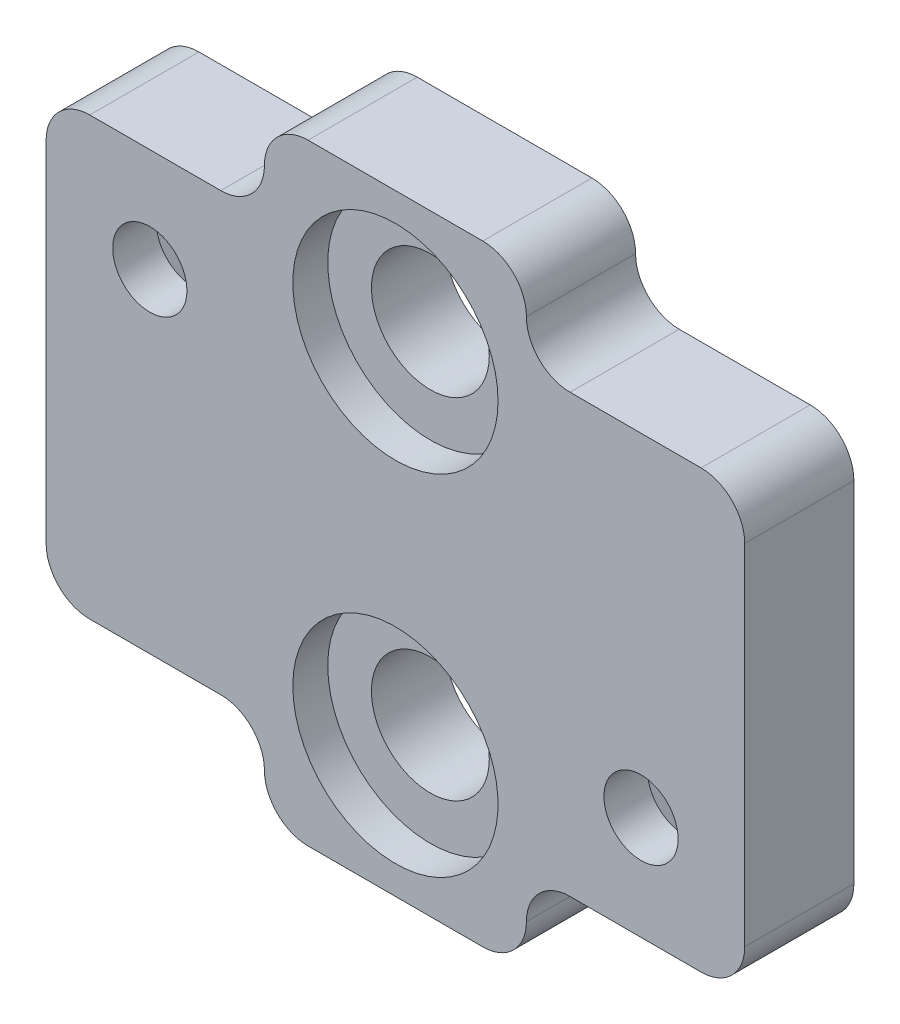
from build123d import *

# Parameters (mm, degrees)
SCHIZZO1_W                   = 32
SCHIZZO1_H                   = 20
ESTRUSIONE_ESTRUSIONE1_DEPTH = 5
SCHIZZO2_R                   = 1.7
TAGLIO_ESTRUSIONE1_DEPTH     = 20.519221296
SCHIZZO3_W                   = 12
SCHIZZO3_H                   = 4
ESTRUSIONE_ESTRUSIONE2_DEPTH = 5
SCHIZZO4_R                   = 4.7
TAGLIO_ESTRUSIONE2_DEPTH     = 1.6
SCHIZZO5_R                   = 2.7
TAGLIO_ESTRUSIONE3_DEPTH     = 22.530443563
TAGLIO_ESTRUSIONE4_DEPTH     = 3
RACCORDO1_R                  = 2


with BuildPart() as part:
    # Schizzo1 → Estrusione-Estrusione1 (new body)
    with BuildSketch(Plane.XY):
        Rectangle(SCHIZZO1_W, SCHIZZO1_H)
    extrude(amount=ESTRUSIONE_ESTRUSIONE1_DEPTH)

    # Schizzo2 → Taglio-Estrusione1 (cut, through all)
    with BuildSketch(Plane.XY.offset(5)):
        with Locations((-11.25, 5.25)):
            Circle(SCHIZZO2_R)
        with Locations((11.25, -5.25)):
            Circle(SCHIZZO2_R)
    extrude(amount=-TAGLIO_ESTRUSIONE1_DEPTH, mode=Mode.SUBTRACT)

    # Schizzo3 → Estrusione-Estrusione2 (add)
    with BuildSketch(Plane.XY):
        with Locations((0, 12)):
            Rectangle(SCHIZZO3_W, SCHIZZO3_H)
        with Locations((0, -12)):
            Rectangle(SCHIZZO3_W, SCHIZZO3_H)
    extrude(amount=ESTRUSIONE_ESTRUSIONE2_DEPTH)

    # Schizzo4 → Taglio-Estrusione2 (cut)
    with BuildSketch(Plane.XY.offset(5)):
        with Locations((0, 8)):
            Circle(SCHIZZO4_R)
        with Locations(Location((0, -8, 0), (0, 0, 180))):
            Circle(SCHIZZO4_R)
    extrude(amount=-TAGLIO_ESTRUSIONE2_DEPTH, mode=Mode.SUBTRACT)

    # Schizzo5 → Taglio-Estrusione3 (cut, through all)
    with BuildSketch(Plane.XY.offset(3.4)):
        with Locations((0, 8)):
            Circle(SCHIZZO5_R)
        with Locations((0, -8)):
            Circle(SCHIZZO5_R)
    extrude(amount=-TAGLIO_ESTRUSIONE3_DEPTH, mode=Mode.SUBTRACT)

    # Schizzo6 → Taglio-Estrusione4 (cut)
    with BuildSketch(Plane(origin=(0, 0, 0), x_dir=(-1, 0, 0), z_dir=(0, 0, -1))):
        Polygon((7.785898385, 5.25), (9.517949192, 2.25), (12.982050808, 2.25), (14.714101615, 5.25), (12.982050808, 8.25), (9.517949192, 8.25), align=None)
        Polygon((-14.714101615, -5.25), (-12.982050808, -8.25), (-9.517949192, -8.25), (-7.785898385, -5.25), (-9.517949192, -2.25), (-12.982050808, -2.25), align=None)
    extrude(amount=-TAGLIO_ESTRUSIONE4_DEPTH, mode=Mode.SUBTRACT)

    # Raccordo1
    raccordo1_edges = [part.edges().sort_by_distance(p)[0] for p in [
        (16, 10, 2.5),
        (16, -10, 2.5),
        (6, -10, 2.5),
        (6, -14, 2.5),
        (-6, -14, 2.5),
        (-6, -10, 2.5),
        (-16, -10, 2.5),
        (-16, 10, 2.5),
        (6, 14, 2.5),
        (-6, 14, 2.5),
        (-6, 10, 2.5),
        (6, 10, 2.5),
    ]]
    fillet(raccordo1_edges, radius=RACCORDO1_R - 0.0001)  # a hair under: the kernel refuses the full size


solid = part.part
